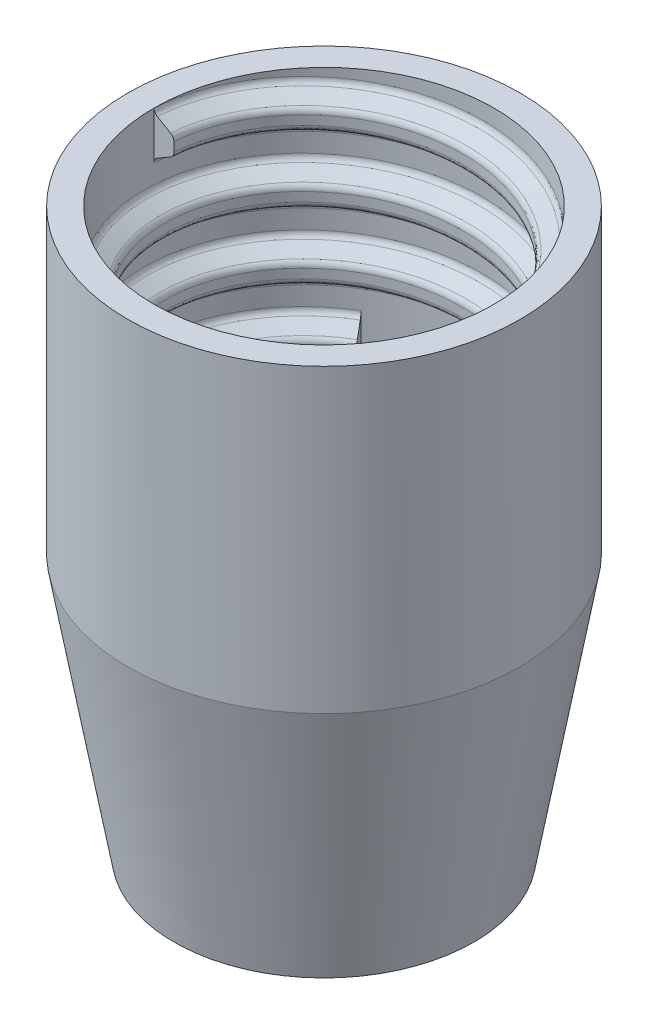
from build123d import *
from build123d.topology import SkipClean

# Parameters (mm, degrees)
SKETCH1_R           = 15
BOSS_EXTRUDE1_DEPTH = 20
SKETCH10_R          = 13
CUT_EXTRUDE2_DEPTH  = 20
THREAD1_PITCH       = 5.08
BOSS_EXTRUDE3_START = 3
SKETCH20_R          = 15
BOSS_EXTRUDE3_DEPTH = 3
SKETCH19_R          = 6.5
CUT_EXTRUDE3_DEPTH  = 1.5
SKETCH47_R          = 0.5
CUT_EXTRUDE10_DEPTH = 1.5
SKETCH49_R          = 0.5
CUT_EXTRUDE13_DEPTH = 1.5
SKETCH50_R          = 0.5
CUT_EXTRUDE14_DEPTH = 1.5
SKETCH51_R          = 0.5
CUT_EXTRUDE15_DEPTH = 1.5
CIRPATTERN1_COUNT   = 18
CIRPATTERN2_COUNT   = 12
CIRPATTERN3_COUNT   = 6
SKETCH52_R          = 15
BOSS_EXTRUDE4_DEPTH = 20
BOSS_EXTRUDE4_TAPER = 10
SKETCH54_R          = 8
CUT_EXTRUDE16_DEPTH = 20


with BuildPart() as part:
    # Sketch1 → Boss-Extrude1 (new body)
    with BuildSketch(Plane(origin=(0, 0, 0), x_dir=(1, 0, 0), z_dir=(0, 1, 0))):
        with Locations(Location((0, 0, 0), (0, 0, 270))):
            Circle(SKETCH1_R)
    extrude(amount=BOSS_EXTRUDE1_DEPTH)

    # Sketch10 → Cut-Extrude2 (cut)
    with BuildSketch(Plane(origin=(0, 20, 0), x_dir=(1, 0, 0), z_dir=(0, 1, 0))):
        with Locations(Location((0, 0, 0), (0, 0, 270))):
            Circle(SKETCH10_R)
    extrude(amount=-CUT_EXTRUDE2_DEPTH, mode=Mode.SUBTRACT)

    # Thread1: the profile of Thread Profile2 profile screwed along a right-hand helix of 3.149606 turns, 12 arcs to a turn; built about Z, then put on its axis
    with SkipClean():  # the faces are left unmerged after this step: merging them gives an invalid solid
        thread1_z = Axis((0, 0, 0), (0, 0, 1))
        thread1_corners = [(13.0006, 0, 0), (13.0006, 0, 3.634587873), (13, 0, 3.634587873), (12.746, 0, 3.194646968), (11.73, 0, 2.608059095), (11.476, 0, 2.16811819), (11.476, 0, 1.466469684), (11.73, 0, 1.026528779), (12.746, 0, 0.439940905), (13, 0, 0)]
        with BuildLine(mode=Mode.PRIVATE) as thread1_profile:
            Line(thread1_corners[0], thread1_corners[1])
            Line(thread1_corners[3], thread1_corners[4])
            Line(thread1_corners[5], thread1_corners[6])
            Line(thread1_corners[7], thread1_corners[8])
            Line(thread1_corners[9], thread1_corners[0])
            Line(thread1_corners[2], thread1_corners[1])
            ThreePointArc((13, 0, 3.634587873), (12.931940905, 0, 3.380587873), (12.746, 0, 3.194646968))
            ThreePointArc((11.73, 0, 2.608059095), (11.544059095, 0, 2.42211819), (11.476, 0, 2.16811819))
            ThreePointArc((11.476, 0, 1.466469684), (11.544059095, 0, 1.212469684), (11.73, 0, 1.026528779))
            ThreePointArc((12.746, 0, 0.439940905), (12.931940905, 0, 0.254), (13, 0, 0))
        thread1_cap = Face(thread1_profile.wire())
        thread1_arcs = [((13, 0, 3.634587873), (13, 0, 3.341293937), (12.746, 0, 3.194646968), (1, 0.866025403784437, 1)), ((11.73, 0, 2.608059095), (11.476, 0, 2.461412127), (11.476, 0, 2.16811819), (1, 0.8660254037844386, 1)), ((11.476, 0, 1.466469684), (11.476, 0, 1.173175747), (11.73, 0, 1.026528779), (1, 0.8660254037844376, 1)), ((12.746, 0, 0.439940905), (13, 0, 0.293293937), (13, 0, 0), (1, 0.8660254037844372, 1))]  # start, shoulder, end, weights
        thread1_turn_angles = [0, 15, 30, 45, 60, 75, 90, 105, 120, 135, 150, 165, 180, 195, 210, 225, 240, 255, 270, 285, 300, 315, 330, 345, 360]
        thread1_turn_weights = [1, 0.9659258262890683, 1, 0.9659258262890683, 1, 0.9659258262890683, 1, 0.9659258262890683, 1, 0.9659258262890683, 1, 0.9659258262890683, 1, 0.9659258262890683, 1, 0.9659258262890683, 1, 0.9659258262890683, 1, 0.9659258262890683, 1, 0.9659258262890683, 1, 0.9659258262890683, 1]
        thread1_turn_rails = [Edge.make_bspline([Vector(p[0], p[1], 0).rotate(thread1_z, thread1_turn_angles[k]) / thread1_turn_weights[k] + Vector(0, 0, p[2] + THREAD1_PITCH * thread1_turn_angles[k] / 360) for k in range(25)], [0, 0, 0, 1, 1, 2, 2, 3, 3, 4, 4, 5, 5, 6, 6, 7, 7, 8, 8, 9, 9, 10, 10, 11, 11, 12, 12, 12], 2, thread1_turn_weights) for p in thread1_corners]
        thread1_turn_sides = [*[Face.make_surface_from_curves(thread1_turn_rails[p[0]], thread1_turn_rails[p[1]]) for p in [(0, 1), (3, 4), (5, 6), (7, 8), (9, 0), (2, 1)]], *[Face.make_bezier_surface([[Vector(p[j][0], p[j][1], 0).rotate(thread1_z, thread1_turn_angles[2 * i + k]) / thread1_turn_weights[2 * i + k] + Vector(0, 0, p[j][2] + THREAD1_PITCH * thread1_turn_angles[2 * i + k] / 360) for k in range(3)] for j in range(3)], [[p[3][j] * thread1_turn_weights[2 * i + k] for k in range(3)] for j in range(3)]) for p in thread1_arcs for i in range(12)]]
        thread1_last_angles = [1080, 1095, 1110, 1121.929133858, 1133.858267717]
        thread1_last_weights = [1, 0.9659258262890683, 1, 0.9784040075425771, 1]
        thread1_last_rails = [Edge.make_bspline([Vector(p[0], p[1], 0).rotate(thread1_z, thread1_last_angles[k]) / thread1_last_weights[k] + Vector(0, 0, p[2] + THREAD1_PITCH * thread1_last_angles[k] / 360) for k in range(5)], [0, 0, 0, 1, 1, 2, 2, 2], 2, thread1_last_weights) for p in thread1_corners]
        thread1_last_sides = [*[Face.make_surface_from_curves(thread1_last_rails[p[0]], thread1_last_rails[p[1]]) for p in [(0, 1), (3, 4), (5, 6), (7, 8), (9, 0), (2, 1)]], *[Face.make_bezier_surface([[Vector(p[j][0], p[j][1], 0).rotate(thread1_z, thread1_last_angles[2 * i + k]) / thread1_last_weights[2 * i + k] + Vector(0, 0, p[j][2] + THREAD1_PITCH * thread1_last_angles[2 * i + k] / 360) for k in range(3)] for j in range(3)], [[p[3][j] * thread1_last_weights[2 * i + k] for k in range(3)] for j in range(3)]) for p in thread1_arcs for i in range(2)]]
        thread1 = Plane(origin=(0, 20, 0), x_dir=(-1, 0, 0), z_dir=(0, -1, 0)) * Solid(Shell([*[p.moved(Location((0, 0, THREAD1_PITCH * i))) for i in range(3) for p in thread1_turn_sides], *thread1_last_sides, thread1_cap, thread1_cap.rotate(thread1_z, 1133.858267717).moved(Location((0, 0, THREAD1_PITCH * 1133.858267717 / 360)))]))
        add(thread1)

    # Sketch20 → Boss-Extrude3 (add)
    with SkipClean():  # the faces are left unmerged after this step: merging them gives an invalid solid
        with BuildSketch(Plane.XZ.offset(BOSS_EXTRUDE3_START)):
            with Locations(Location((0, 0, 0), (0, 0, 270))):
                Circle(SKETCH20_R)
        extrude(amount=-BOSS_EXTRUDE3_DEPTH)

    # Sketch19 → Cut-Extrude3 (cut)
    with SkipClean():  # the faces are left unmerged after this step: merging them gives an invalid solid
        with BuildSketch(Plane(origin=(0, 0, 0), x_dir=(-1, 0, 0), z_dir=(0, -1, 0))):
            with Locations(Location((0, 0, 0), (0, 0, 90))):
                Circle(SKETCH19_R)
        extrude(amount=CUT_EXTRUDE3_DEPTH, mode=Mode.SUBTRACT)

    # Sketch47 → Cut-Extrude10 (cut)
    with SkipClean():  # the faces are left unmerged after this step: merging them gives an invalid solid
        with BuildSketch(Plane(origin=(0, -1.5, 0), x_dir=(1, 0, 0), z_dir=(0, 1, 0))):
            with Locations(Location((0, 0, 0), (0, 0, 270))):
                Circle(SKETCH47_R)
        extrude(amount=-CUT_EXTRUDE10_DEPTH, mode=Mode.SUBTRACT)

    # Sketch49 → Cut-Extrude13 (cut)
    with SkipClean():  # the faces are left unmerged after this step: merging them gives an invalid solid
        with BuildSketch(Plane(origin=(0, -1.5, 0), x_dir=(1, 0, 0), z_dir=(0, 1, 0))):
            with Locations(Location((0, 0, 0), (0, 0, 270))):
                Circle(SKETCH49_R)
            with Locations(Location((1.67, 0, 0), (0, 0, 270))):
                Circle(SKETCH49_R)
        cut_extrude13 = extrude(amount=-CUT_EXTRUDE13_DEPTH, mode=Mode.SUBTRACT)

    # Sketch50 → Cut-Extrude14 (cut)
    with SkipClean():  # the faces are left unmerged after this step: merging them gives an invalid solid
        with BuildSketch(Plane(origin=(0, -1.5, 0), x_dir=(1, 0, 0), z_dir=(0, 1, 0))):
            with Locations(Location((3.33, 0, 0), (0, 0, 270))):
                Circle(SKETCH50_R)
        cut_extrude14 = extrude(amount=-CUT_EXTRUDE14_DEPTH, mode=Mode.SUBTRACT)

    # Sketch51 → Cut-Extrude15 (cut)
    with SkipClean():  # the faces are left unmerged after this step: merging them gives an invalid solid
        with BuildSketch(Plane(origin=(0, -1.5, 0), x_dir=(1, 0, 0), z_dir=(0, 1, 0))):
            with Locations(Location((5, 0, 0), (0, 0, 270))):
                Circle(SKETCH51_R)
        cut_extrude15 = extrude(amount=-CUT_EXTRUDE15_DEPTH, mode=Mode.SUBTRACT)

    # CirPattern1: Cut-Extrude15 ×18 about axis
    with SkipClean():  # the faces are left unmerged after this step: merging them gives an invalid solid
        cirpattern1_axis = Axis((0, 0, 0), (0, 1, 0))
        for i in range(1, CIRPATTERN1_COUNT):
            add(cut_extrude15.rotate(cirpattern1_axis, i * 360 / CIRPATTERN1_COUNT), mode=Mode.SUBTRACT)

    # CirPattern2: Cut-Extrude14 ×12 about axis
    with SkipClean():  # the faces are left unmerged after this step: merging them gives an invalid solid
        cirpattern2_axis = Axis((0, 0, 0), (0, 1, 0))
        for i in range(1, CIRPATTERN2_COUNT):
            add(cut_extrude14.rotate(cirpattern2_axis, i * 360 / CIRPATTERN2_COUNT), mode=Mode.SUBTRACT)

    # CirPattern3: Cut-Extrude13 ×6 about axis
    with SkipClean():  # the faces are left unmerged after this step: merging them gives an invalid solid
        cirpattern3_axis = Axis((0, 0, 0), (0, 1, 0))
        for i in range(1, CIRPATTERN3_COUNT):
            add(cut_extrude13.rotate(cirpattern3_axis, i * 360 / CIRPATTERN3_COUNT), mode=Mode.SUBTRACT)

    # Sketch52 → Boss-Extrude4 (add)
    with SkipClean():  # the faces are left unmerged after this step: merging them gives an invalid solid
        with BuildSketch(Plane(origin=(0, -3, 0), x_dir=(-1, 0, 0), z_dir=(0, -1, 0))):
            with Locations(Location((0, 0, 0), (0, 0, 90))):
                Circle(SKETCH52_R)
        extrude(amount=BOSS_EXTRUDE4_DEPTH, taper=BOSS_EXTRUDE4_TAPER)

    # Sketch54 → Cut-Extrude16 (cut)
    with SkipClean():  # the faces are left unmerged after this step: merging them gives an invalid solid
        with BuildSketch(Plane.XZ.offset(23)):
            with Locations(Location((0, 0, 0), (0, 0, 270))):
                Circle(SKETCH54_R)
        extrude(amount=-CUT_EXTRUDE16_DEPTH, mode=Mode.SUBTRACT)


solid = part.part
